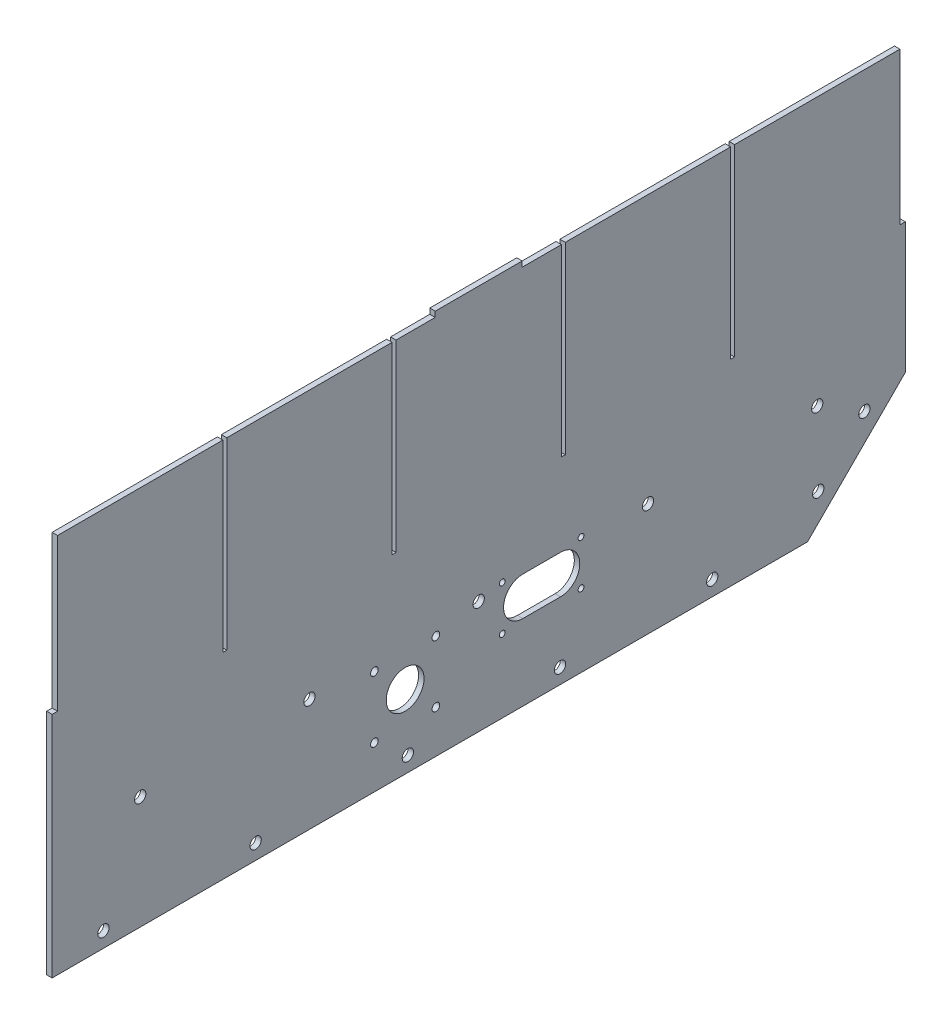
from build123d import *

# Parameters (mm, degrees)
SKETCH1_W            = 498.348
SKETCH1_H            = 165.1
BOSS_EXTRUDE1_DEPTH  = 1.5875
BOSS_EXTRUDE2_DEPTH  = 3.175
SKETCH3_R            = 3.302
CUT_EXTRUDE1_DEPTH   = 286.681383539
LPATTERN1_COUNT      = 5
LPATTERN1_PITCH      = 88.9
SKETCH4_R            = 3.302
CUT_EXTRUDE2_DEPTH   = 286.681383539
LPATTERN2_COUNT      = 2
LPATTERN2_PITCH      = 38.1
SKETCH5_W            = 3.175
SKETCH5_H            = 88.9
CUT_EXTRUDE3_DEPTH   = 286.681383539
SKETCH6_W            = 2.286
SKETCH6_H            = 107.442
CUT_EXTRUDE4_DEPTH   = 286.681383539
LPATTERN3_COUNT      = 4
LPATTERN3_PITCH      = 98.8568
SKETCH8_W            = 50.8
SKETCH8_H            = 3.175
BOSS_EXTRUDE3_DEPTH  = 3.175
SKETCH9_R            = 11.05
CUT_EXTRUDE5_DEPTH   = 286.681383539
M6_CLEARANCE_HOLE1_D = 6.6
LPATTERN4_COUNT      = 3
LPATTERN4_PITCH      = 98.8568
LPATTERN4_COUNT_DIR2 = 3
LPATTERN4_PITCH_DIR2 = 98.8568
M4_CLEARANCE_HOLE1_D = 4.5
CUT_EXTRUDE6_DEPTH   = 286.681383539
M3_CLEARANCE_HOLE1_D = 3.4


with BuildPart() as part:
    # Sketch1 → Boss-Extrude1 (new, symmetric)
    with BuildSketch(Plane(origin=(0, 0, 0), x_dir=(0, 0, -1), z_dir=(1, 0, 0))):
        Rectangle(SKETCH1_W, SKETCH1_H)
    extrude(amount=BOSS_EXTRUDE1_DEPTH, both=True)

    # Sketch2 → Boss-Extrude2 (add)
    with BuildSketch(Plane(origin=(1.5875, 0, 0), x_dir=(0, 0, -1), z_dir=(1, 0, 0))):
        Polygon((192.024, -139.7), (249.174, -82.55), (-249.174, -82.55), (-249.174, -139.7), align=None)
    extrude(amount=-BOSS_EXTRUDE2_DEPTH)

    # Sketch3 → Cut-Extrude1 (cut, through all)
    with BuildSketch(Plane.ZY.offset(1.5875)):
        with Locations((219.202, -130.81)):
            Circle(SKETCH3_R)
    cut_extrude1 = extrude(amount=-CUT_EXTRUDE1_DEPTH, mode=Mode.SUBTRACT)

    # LPattern1: Cut-Extrude1 ×5
    with Locations(*[(0, 0, -i * LPATTERN1_PITCH) for i in range(1, LPATTERN1_COUNT)]):
        add(cut_extrude1, mode=Mode.SUBTRACT)

    # Sketch4 → Cut-Extrude2 (cut, symmetric)
    with BuildSketch(Plane.ZY.offset(1.5875)):
        with Locations((-198.310179285, -117.249359697)):
            Circle(SKETCH4_R)
    cut_extrude2 = extrude(amount=CUT_EXTRUDE2_DEPTH, both=True, mode=Mode.SUBTRACT)

    # LPattern2: Cut-Extrude2 ×2
    with Locations(*[Vector(0, 0.7071067811865439, -0.7071067811865512) * (i * LPATTERN2_PITCH) for i in range(1, LPATTERN2_COUNT)]):
        add(cut_extrude2, mode=Mode.SUBTRACT)

    # Sketch5 → Cut-Extrude3 (cut, through all)
    with BuildSketch(Plane(origin=(1.5875, 0, 0), x_dir=(0, 0, -1), z_dir=(1, 0, 0))):
        with Locations((247.5865, 38.1)):
            Rectangle(SKETCH5_W, SKETCH5_H)
        with Locations((-247.5865, 38.1)):
            Rectangle(SKETCH5_W, SKETCH5_H)
    extrude(amount=-CUT_EXTRUDE3_DEPTH, mode=Mode.SUBTRACT)

    # Sketch6 → Cut-Extrude4 (cut, through all)
    with BuildSketch(Plane(origin=(1.5875, 0, 0), x_dir=(0, 0, -1), z_dir=(1, 0, 0))):
        with Locations((148.2852, 28.829)):
            Rectangle(SKETCH6_W, SKETCH6_H)
    cut_extrude4 = extrude(amount=-CUT_EXTRUDE4_DEPTH, mode=Mode.SUBTRACT)

    # LPattern3: Cut-Extrude4 ×4
    with Locations(*[(0, 0, i * LPATTERN3_PITCH) for i in range(1, LPATTERN3_COUNT)]):
        add(cut_extrude4, mode=Mode.SUBTRACT)

    # Sketch8 → Boss-Extrude3 (add)
    with BuildSketch(Plane(origin=(1.5875, 0, 0), x_dir=(0, 0, -1), z_dir=(1, 0, 0))):
        with Locations((0, 84.1375)):
            Rectangle(SKETCH8_W, SKETCH8_H)
    extrude(amount=-BOSS_EXTRUDE3_DEPTH)

    # Sketch9 → Cut-Extrude5 (cut, through all)
    with BuildSketch(Plane(origin=(1.5875, 0, 0), x_dir=(0, 0, -1), z_dir=(1, 0, 0))):
        with Locations((-42.9768, -96.7994)):
            Circle(SKETCH9_R)
    extrude(amount=-CUT_EXTRUDE5_DEPTH, mode=Mode.SUBTRACT)

    # M6 Clearance Hole1 (through all)
    with Locations(Plane(origin=(1.5875, 0, 0), x_dir=(0, 0, -1), z_dir=(1, 0, 0))):
        with Locations((0, -73.8124)):
            m6_clearance_hole1 = Hole(M6_CLEARANCE_HOLE1_D / 2)

    # LPattern4: M6 Clearance Hole1 3 × 3
    with Locations(*[Vector(0, 0, 1) * (i * LPATTERN4_PITCH) + Vector(0, 0, -1) * (j * LPATTERN4_PITCH_DIR2) for i in range(LPATTERN4_COUNT) for j in range(LPATTERN4_COUNT_DIR2) if (i, j) != (0, 0)]):
        add(m6_clearance_hole1, mode=Mode.SUBTRACT)

    # M4 Clearance Hole1 (through all)
    with Locations(Plane(origin=(1.5875, 0, 0), x_dir=(0, 0, -1), z_dir=(1, 0, 0))):
        with Locations((-25.0163, -78.8389), (-60.9373, -78.8389), (-60.9373, -114.7599), (-25.0163, -114.7599)):
            Hole(M4_CLEARANCE_HOLE1_D / 2)

    # Sketch14 → Cut-Extrude6 (cut, through all)
    with BuildSketch(Plane(origin=(1.5875, 0, 0), x_dir=(0, 0, -1), z_dir=(1, 0, 0))):
        with BuildLine():
            Line((25.7662, -95.3542), (47.7662, -95.3542))
            ThreePointArc((47.7662, -95.3542), (59.0162, -84.1042), (47.7662, -72.8542))
            Line((47.7662, -72.8542), (25.7662, -72.8542))
            ThreePointArc((25.7662, -72.8542), (14.5162, -84.1042), (25.7662, -95.3542))
        make_face()
    extrude(amount=-CUT_EXTRUDE6_DEPTH, mode=Mode.SUBTRACT)

    # M3 Clearance Hole1 (through all)
    with Locations(Plane(origin=(1.5875, 0, 0), x_dir=(0, 0, -1), z_dir=(1, 0, 0))):
        with Locations((59.7662, -97.1042), (59.7662, -71.1042), (13.7662, -71.1042), (13.7662, -97.1042)):
            Hole(M3_CLEARANCE_HOLE1_D / 2)


solid = part.part
